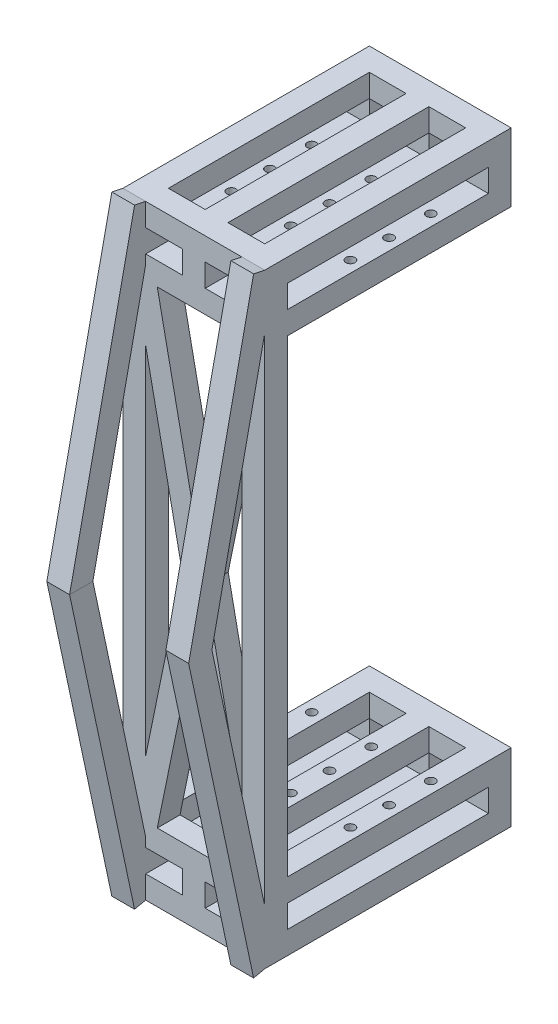
from build123d import *

# Parameters (mm, degrees)
SZKIC2_W                         = 187
SZKIC2_H                         = 90
SZKIC2_W_2                       = 48.5
SZKIC2_H_2                       = 30
DODANIE_WYCI_GNI_CIE1_DEPTH      = 30
DODANIE_WYCI_GNI_CIE1_2_DEPTH    = 30
SZKIC3_W                         = 187
SZKIC3_H                         = 90
SZKIC3_W_2                       = 48.5
SZKIC3_H_2                       = 30
DODANIE_WYCI_GNI_CIE2_DEPTH      = 30
DODANIE_WYCI_GNI_CIE2_2_DEPTH    = 30
SZKIC4_W                         = 30
SZKIC4_H                         = 30
DODANIE_WYCI_GNI_CIE3_DEPTH      = 295
DODANIE_WYCI_GNI_CIE4_DEPTH      = 30
OTWORY_USTALAJ_CE_12_0MM1_REACH  = 803.16
OTWORY_USTALAJ_CE_12_0MM1_BORE_R = 6
OTWORY_USTALAJ_CE_12_0MM2_REACH  = 803.16
OTWORY_USTALAJ_CE_12_0MM2_BORE_R = 6
OTWORY_USTALAJ_CE_12_0MM3_REACH  = 803.16
OTWORY_USTALAJ_CE_12_0MM3_BORE_R = 6
SZKIC18_W                        = 30
SZKIC18_H                        = 30
SKORUPA4_START                   = 3
SKORUPA4_OUTLINE_W               = 24
SKORUPA4_OUTLINE_H               = 24
SKORUPA4_OUTLINE_W_2             = 672
SKORUPA4_DEPTH                   = 181
SKORUPA4_2_OUTLINE_W             = 24
SKORUPA4_2_OUTLINE_H             = 271
SKORUPA4_2_OUTLINE_W_2           = 36
SKORUPA4_2_OUTLINE_H_2           = 24
SKORUPA4_2_DEPTH                 = 24
SKORUPA4_START_2                 = 160
SKORUPA4_3_OUTLINE_W             = 24
SKORUPA4_3_OUTLINE_H             = 271
SKORUPA4_3_OUTLINE_W_2           = 36
SKORUPA4_3_OUTLINE_H_2           = 24
SKORUPA4_3_DEPTH                 = 24
SKORUPA4_START_3                 = 81.5
SKORUPA4_4_OUTLINE_W             = 24
SKORUPA4_4_OUTLINE_H             = 271
SKORUPA4_4_OUTLINE_W_2           = 36
SKORUPA4_4_OUTLINE_H_2           = 24
SKORUPA4_4_DEPTH                 = 24
SKORUPA4_START_4                 = 298
SKORUPA4_5_DEPTH                 = 25
SKORUPA4_START_5                 = -736
SKORUPA4_6_OUTLINE_R             = 9
SKORUPA4_6_OUTLINE_R_2           = 6
SKORUPA4_6_DEPTH                 = 25
SKORUPA4_START_6                 = -87
SKORUPA4_7_OUTLINE_R             = 9
SKORUPA4_7_OUTLINE_R_2           = 6
SKORUPA4_7_DEPTH                 = 25


with BuildPart() as part:
    # Szkic2 → Dodanie-wyciągnięcie1 (new body)
    with BuildSketch(Plane(origin=(0, 0, 0), x_dir=(-1, 0, 0), z_dir=(0, 0, 1))):
        with Locations((-93.5, 753)):
            Rectangle(SZKIC2_W, SZKIC2_H)
        with Locations((-132.75, 753)):
            Rectangle(SZKIC2_W_2, SZKIC2_H_2, mode=Mode.SUBTRACT)
        with Locations((-54.25, 753)):
            Rectangle(SZKIC2_W_2, SZKIC2_H_2, mode=Mode.SUBTRACT)
    extrude(amount=DODANIE_WYCI_GNI_CIE1_DEPTH)



with BuildPart() as body_2:
    # Szkic2 → Dodanie-wyci_gni_cie1 2 (new body)
    with BuildSketch(Plane(origin=(0, 0, 0), x_dir=(-1, 0, 0), z_dir=(0, 0, 1))):
        with Locations((-93.5, 45)):
            Rectangle(SZKIC2_W, SZKIC2_H)
        with Locations((-54.25, 45)):
            Rectangle(SZKIC2_W_2, SZKIC2_H_2, mode=Mode.SUBTRACT)
        with Locations((-132.75, 45)):
            Rectangle(SZKIC2_W_2, SZKIC2_H_2, mode=Mode.SUBTRACT)
    extrude(amount=DODANIE_WYCI_GNI_CIE1_2_DEPTH)


with BuildPart() as body_3:
    # Szkic3 → Dodanie-wyciągnięcie2 (new body)
    with BuildSketch(Plane.XY.offset(295)):
        with Locations((93.5, -753)):
            Rectangle(SZKIC3_W, SZKIC3_H)
        with Locations((132.75, -753)):
            Rectangle(SZKIC3_W_2, SZKIC3_H_2, mode=Mode.SUBTRACT)
        with Locations((54.25, -753)):
            Rectangle(SZKIC3_W_2, SZKIC3_H_2, mode=Mode.SUBTRACT)
    extrude(amount=DODANIE_WYCI_GNI_CIE2_DEPTH)


with BuildPart() as body_4:
    # Szkic3 → Dodanie-wyci_gni_cie2 2 (new body)
    with BuildSketch(Plane.XY.offset(295)):
        with Locations((93.5, -45)):
            Rectangle(SZKIC3_W, SZKIC3_H)
        with Locations((132.75, -45)):
            Rectangle(SZKIC3_W_2, SZKIC3_H_2, mode=Mode.SUBTRACT)
        with Locations((54.25, -45)):
            Rectangle(SZKIC3_W_2, SZKIC3_H_2, mode=Mode.SUBTRACT)
    extrude(amount=DODANIE_WYCI_GNI_CIE2_2_DEPTH)


with BuildPart() as part_1:
    add(part.part)

    add(body_2.part)  # Dodanie-wyciągnięcie3 merges body 2

    add(body_3.part)  # Dodanie-wyciągnięcie3 merges body 3

    add(body_4.part)  # Dodanie-wyciągnięcie3 merges body 4
    # Szkic4 → Dodanie-wyciągnięcie3 (add)
    with BuildSketch(Plane.XY.offset(30)):
        with Locations((15, -15)):
            Rectangle(SZKIC4_W, SZKIC4_H)
        with Locations((93.5, -15)):
            Rectangle(SZKIC4_W, SZKIC4_H)
        with Locations((172, -15)):
            Rectangle(SZKIC4_W, SZKIC4_H)
        with Locations((172, -75)):
            Rectangle(SZKIC4_W, SZKIC4_H)
        with Locations((93.5, -75)):
            Rectangle(SZKIC4_W, SZKIC4_H)
        with Locations((15, -75)):
            Rectangle(SZKIC4_W, SZKIC4_H)
        with Locations((15, -723)):
            Rectangle(SZKIC4_W, SZKIC4_H)
        with Locations((93.5, -723)):
            Rectangle(SZKIC4_W, SZKIC4_H)
        with Locations((172, -723)):
            Rectangle(SZKIC4_W, SZKIC4_H)
        with Locations((172, -783)):
            Rectangle(SZKIC4_W, SZKIC4_H)
        with Locations((93.5, -783)):
            Rectangle(SZKIC4_W, SZKIC4_H)
        with Locations((15, -783)):
            Rectangle(SZKIC4_W, SZKIC4_H)
    extrude(amount=DODANIE_WYCI_GNI_CIE3_DEPTH)

    # Szkic5 → Dodanie-wyciągnięcie4 (add)
    with BuildSketch(Plane.XY.offset(325)):
        Polygon((187, -90), (187, -708), (141.686543307, -708), (93.5, -473.517450679), (45.313456693, -708), (0, -708), (0, -90), (45.313456693, -90), (93.5, -324.482549321), (141.686543307, -90), align=None)
        Polygon((157, -164.517450679), (157, -633.482549321), (108.813456693, -399), align=None, mode=Mode.SUBTRACT)
        Polygon((30, -164.517450679), (30, -633.482549321), (78.186543307, -399), align=None, mode=Mode.SUBTRACT)
    extrude(amount=-DODANIE_WYCI_GNI_CIE4_DEPTH)

    # Otwory ustalające Ø12.0mm1 bore → Otwory ustalające Ø12.0mm1 (cut, up to next)
    with BuildSketch(Plane(origin=(0, -708, 0), x_dir=(1, 0, 0), z_dir=(0, 1, 0)), mode=Mode.PRIVATE) as otwory_ustalaj_ce_12_0mm1_sk1:
        with Locations((172, -146)):
            Circle(OTWORY_USTALAJ_CE_12_0MM1_BORE_R)
    otwory_ustalaj_ce_12_0mm1_tool1 = extrude(otwory_ustalaj_ce_12_0mm1_sk1.sketch, amount=-OTWORY_USTALAJ_CE_12_0MM1_REACH, mode=Mode.PRIVATE) & part_1.part
    # Otwory ustalające Ø12.0mm1 bore → Otwory ustalające Ø12.0mm1 (cut, up to next)
    with BuildSketch(Plane(origin=(0, -708, 0), x_dir=(1, 0, 0), z_dir=(0, 1, 0)), mode=Mode.PRIVATE) as otwory_ustalaj_ce_12_0mm1_sk2:
        with Locations((172, -197)):
            Circle(OTWORY_USTALAJ_CE_12_0MM1_BORE_R)
    otwory_ustalaj_ce_12_0mm1_tool2 = extrude(otwory_ustalaj_ce_12_0mm1_sk2.sketch, amount=-OTWORY_USTALAJ_CE_12_0MM1_REACH, mode=Mode.PRIVATE) & part_1.part
    # Otwory ustalające Ø12.0mm1 bore → Otwory ustalające Ø12.0mm1 (cut, up to next)
    with BuildSketch(Plane(origin=(0, -708, 0), x_dir=(1, 0, 0), z_dir=(0, 1, 0)), mode=Mode.PRIVATE) as otwory_ustalaj_ce_12_0mm1_sk3:
        with Locations((172, -91)):
            Circle(OTWORY_USTALAJ_CE_12_0MM1_BORE_R)
    otwory_ustalaj_ce_12_0mm1_tool3 = extrude(otwory_ustalaj_ce_12_0mm1_sk3.sketch, amount=-OTWORY_USTALAJ_CE_12_0MM1_REACH, mode=Mode.PRIVATE) & part_1.part
    otwory_ustalaj_ce_12_0mm1_1 = otwory_ustalaj_ce_12_0mm1_tool1.solids().sort_by_distance((172, -708, 146))[0]
    add(otwory_ustalaj_ce_12_0mm1_1, mode=Mode.SUBTRACT)
    otwory_ustalaj_ce_12_0mm1_2 = otwory_ustalaj_ce_12_0mm1_tool2.solids().sort_by_distance((172, -708, 197))[0]
    add(otwory_ustalaj_ce_12_0mm1_2, mode=Mode.SUBTRACT)
    otwory_ustalaj_ce_12_0mm1_3 = otwory_ustalaj_ce_12_0mm1_tool3.solids().sort_by_distance((172, -708, 91))[0]
    add(otwory_ustalaj_ce_12_0mm1_3, mode=Mode.SUBTRACT)
    otwory_ustalaj_ce_12_0mm1 = otwory_ustalaj_ce_12_0mm1_1 + otwory_ustalaj_ce_12_0mm1_2 + otwory_ustalaj_ce_12_0mm1_3  # Otwory ustalające Ø12.0mm1 as one shape, for the pattern or mirror that repeats it

    # Otwory ustalające Ø12.0mm2 bore → Otwory ustalające Ø12.0mm2 (cut, up to next)
    with BuildSketch(Plane(origin=(0, -708, 0), x_dir=(1, 0, 0), z_dir=(0, 1, 0)), mode=Mode.PRIVATE) as otwory_ustalaj_ce_12_0mm2_sk1:
        with Locations((93.5, -146)):
            Circle(OTWORY_USTALAJ_CE_12_0MM2_BORE_R)
    otwory_ustalaj_ce_12_0mm2_tool1 = extrude(otwory_ustalaj_ce_12_0mm2_sk1.sketch, amount=-OTWORY_USTALAJ_CE_12_0MM2_REACH, mode=Mode.PRIVATE) & part_1.part
    # Otwory ustalające Ø12.0mm2 bore → Otwory ustalające Ø12.0mm2 (cut, up to next)
    with BuildSketch(Plane(origin=(0, -708, 0), x_dir=(1, 0, 0), z_dir=(0, 1, 0)), mode=Mode.PRIVATE) as otwory_ustalaj_ce_12_0mm2_sk2:
        with Locations((93.5, -91)):
            Circle(OTWORY_USTALAJ_CE_12_0MM2_BORE_R)
    otwory_ustalaj_ce_12_0mm2_tool2 = extrude(otwory_ustalaj_ce_12_0mm2_sk2.sketch, amount=-OTWORY_USTALAJ_CE_12_0MM2_REACH, mode=Mode.PRIVATE) & part_1.part
    # Otwory ustalające Ø12.0mm2 bore → Otwory ustalające Ø12.0mm2 (cut, up to next)
    with BuildSketch(Plane(origin=(0, -708, 0), x_dir=(1, 0, 0), z_dir=(0, 1, 0)), mode=Mode.PRIVATE) as otwory_ustalaj_ce_12_0mm2_sk3:
        with Locations((93.5, -197)):
            Circle(OTWORY_USTALAJ_CE_12_0MM2_BORE_R)
    otwory_ustalaj_ce_12_0mm2_tool3 = extrude(otwory_ustalaj_ce_12_0mm2_sk3.sketch, amount=-OTWORY_USTALAJ_CE_12_0MM2_REACH, mode=Mode.PRIVATE) & part_1.part
    otwory_ustalaj_ce_12_0mm2_1 = otwory_ustalaj_ce_12_0mm2_tool1.solids().sort_by_distance((93.5, -708, 146))[0]
    add(otwory_ustalaj_ce_12_0mm2_1, mode=Mode.SUBTRACT)
    otwory_ustalaj_ce_12_0mm2_2 = otwory_ustalaj_ce_12_0mm2_tool2.solids().sort_by_distance((93.5, -708, 91))[0]
    add(otwory_ustalaj_ce_12_0mm2_2, mode=Mode.SUBTRACT)
    otwory_ustalaj_ce_12_0mm2_3 = otwory_ustalaj_ce_12_0mm2_tool3.solids().sort_by_distance((93.5, -708, 197))[0]
    add(otwory_ustalaj_ce_12_0mm2_3, mode=Mode.SUBTRACT)
    otwory_ustalaj_ce_12_0mm2 = otwory_ustalaj_ce_12_0mm2_1 + otwory_ustalaj_ce_12_0mm2_2 + otwory_ustalaj_ce_12_0mm2_3  # Otwory ustalające Ø12.0mm2 as one shape, for the pattern or mirror that repeats it

    # Otwory ustalające Ø12.0mm3 bore → Otwory ustalające Ø12.0mm3 (cut, up to next)
    with BuildSketch(Plane(origin=(0, -708, 0), x_dir=(1, 0, 0), z_dir=(0, 1, 0)), mode=Mode.PRIVATE) as otwory_ustalaj_ce_12_0mm3_sk1:
        with Locations((15, -146)):
            Circle(OTWORY_USTALAJ_CE_12_0MM3_BORE_R)
    otwory_ustalaj_ce_12_0mm3_tool1 = extrude(otwory_ustalaj_ce_12_0mm3_sk1.sketch, amount=-OTWORY_USTALAJ_CE_12_0MM3_REACH, mode=Mode.PRIVATE) & part_1.part
    # Otwory ustalające Ø12.0mm3 bore → Otwory ustalające Ø12.0mm3 (cut, up to next)
    with BuildSketch(Plane(origin=(0, -708, 0), x_dir=(1, 0, 0), z_dir=(0, 1, 0)), mode=Mode.PRIVATE) as otwory_ustalaj_ce_12_0mm3_sk2:
        with Locations((15, -91)):
            Circle(OTWORY_USTALAJ_CE_12_0MM3_BORE_R)
    otwory_ustalaj_ce_12_0mm3_tool2 = extrude(otwory_ustalaj_ce_12_0mm3_sk2.sketch, amount=-OTWORY_USTALAJ_CE_12_0MM3_REACH, mode=Mode.PRIVATE) & part_1.part
    # Otwory ustalające Ø12.0mm3 bore → Otwory ustalające Ø12.0mm3 (cut, up to next)
    with BuildSketch(Plane(origin=(0, -708, 0), x_dir=(1, 0, 0), z_dir=(0, 1, 0)), mode=Mode.PRIVATE) as otwory_ustalaj_ce_12_0mm3_sk3:
        with Locations((15, -197)):
            Circle(OTWORY_USTALAJ_CE_12_0MM3_BORE_R)
    otwory_ustalaj_ce_12_0mm3_tool3 = extrude(otwory_ustalaj_ce_12_0mm3_sk3.sketch, amount=-OTWORY_USTALAJ_CE_12_0MM3_REACH, mode=Mode.PRIVATE) & part_1.part
    otwory_ustalaj_ce_12_0mm3_1 = otwory_ustalaj_ce_12_0mm3_tool1.solids().sort_by_distance((15, -708, 146))[0]
    add(otwory_ustalaj_ce_12_0mm3_1, mode=Mode.SUBTRACT)
    otwory_ustalaj_ce_12_0mm3_2 = otwory_ustalaj_ce_12_0mm3_tool2.solids().sort_by_distance((15, -708, 91))[0]
    add(otwory_ustalaj_ce_12_0mm3_2, mode=Mode.SUBTRACT)
    otwory_ustalaj_ce_12_0mm3_3 = otwory_ustalaj_ce_12_0mm3_tool3.solids().sort_by_distance((15, -708, 197))[0]
    add(otwory_ustalaj_ce_12_0mm3_3, mode=Mode.SUBTRACT)
    otwory_ustalaj_ce_12_0mm3 = otwory_ustalaj_ce_12_0mm3_1 + otwory_ustalaj_ce_12_0mm3_2 + otwory_ustalaj_ce_12_0mm3_3  # Otwory ustalające Ø12.0mm3 as one shape, for the pattern or mirror that repeats it

    # Wyciągnięcie po ścieżce1: sweep along a path in Szkic17
    with BuildLine(Plane(origin=(15, 0, 0), x_dir=(0, 0, -1), z_dir=(1, 0, 0))) as wyci_gni_cie_po_cie_ce1_path:
        Line((-325, 0), (-410, -399))
        Line((-410, -399), (-325, -798))
    # Szkic18 → Wyciągnięcie po ścieżce1 (sweep)
    with BuildSketch(Plane(origin=(15, 0, 325), x_dir=(-1, 0, 0), z_dir=(0, -0.9780528166099424, 0.20835711632041382))):
        Rectangle(SZKIC18_W, SZKIC18_H)
    wyci_gni_cie_po_cie_ce1 = sweep(path=wyci_gni_cie_po_cie_ce1_path.line, transition=Transition.RIGHT)

    # Lustro4: Otwory ustalające Ø12.0mm1, Otwory ustalające Ø12.0mm2, Otwory ustalające Ø12.0mm3 across plane
    add(otwory_ustalaj_ce_12_0mm1.mirror(Plane.ZX.offset(-399)), mode=Mode.SUBTRACT)
    add(otwory_ustalaj_ce_12_0mm2.mirror(Plane.ZX.offset(-399)), mode=Mode.SUBTRACT)
    add(otwory_ustalaj_ce_12_0mm3.mirror(Plane.ZX.offset(-399)), mode=Mode.SUBTRACT)

    # Lustro5: Wyciągnięcie po ścieżce1 across plane
    add(wyci_gni_cie_po_cie_ce1.mirror(Plane.ZY.offset(-93.5)))

    # Skorupa4: read off the stored shape, not the designer's step
    # Skorupa4 outline → Skorupa4 (cut)
    with BuildSketch(Plane.YZ.offset(SKORUPA4_START)):
        with Locations((-75, 15)):
            Rectangle(SKORUPA4_OUTLINE_W, SKORUPA4_OUTLINE_H)
        with Locations((-399, 310)):
            Rectangle(SKORUPA4_OUTLINE_W_2, SKORUPA4_OUTLINE_H)
        with Locations((-15, 15)):
            Rectangle(SKORUPA4_OUTLINE_W, SKORUPA4_OUTLINE_H)
        with Locations((-15, 310)):
            Rectangle(SKORUPA4_OUTLINE_W, SKORUPA4_OUTLINE_H)
        with Locations((-723, 15)):
            Rectangle(SKORUPA4_OUTLINE_W, SKORUPA4_OUTLINE_H)
        with Locations((-783, 310)):
            Rectangle(SKORUPA4_OUTLINE_W, SKORUPA4_OUTLINE_H)
        with Locations((-783, 15)):
            Rectangle(SKORUPA4_OUTLINE_W, SKORUPA4_OUTLINE_H)
    extrude(amount=SKORUPA4_DEPTH, mode=Mode.SUBTRACT)

    # Skorupa4 2 outline → Skorupa4 2 (cut)
    with BuildSketch(Plane.YZ.offset(SKORUPA4_START)):
        with Locations((-75, 162.5)):
            Rectangle(SKORUPA4_2_OUTLINE_W, SKORUPA4_2_OUTLINE_H)
        with Locations((-45, 15)):
            Rectangle(SKORUPA4_2_OUTLINE_W_2, SKORUPA4_2_OUTLINE_H_2)
        Polygon((-63, 322), (-63, 298), (-27, 298), (-27, 322), (-3, 322), (-3, 325.316003366), (-0.433873054, 337.361705148), (-399, 422.269276052), (-797.566126946, 337.361705148), (-795, 325.316003366), (-795, 322), (-771, 322), (-771, 298), (-735, 298), (-735, 322), (-754.488927711, 322), (-399, 397.730723948), (-43.511072289, 322), align=None)
        with Locations((-723, 162.5)):
            Rectangle(SKORUPA4_2_OUTLINE_W, SKORUPA4_2_OUTLINE_H)
        with Locations((-15, 162.5)):
            Rectangle(SKORUPA4_2_OUTLINE_W, SKORUPA4_2_OUTLINE_H)
        with Locations((-753, 15)):
            Rectangle(SKORUPA4_2_OUTLINE_W_2, SKORUPA4_2_OUTLINE_H_2)
        with Locations((-783, 162.5)):
            Rectangle(SKORUPA4_2_OUTLINE_W, SKORUPA4_2_OUTLINE_H)
    extrude(amount=SKORUPA4_2_DEPTH, mode=Mode.SUBTRACT)

    # Skorupa4 3 outline → Skorupa4 3 (cut)
    with BuildSketch(Plane.YZ.offset(SKORUPA4_START_2)):
        with Locations((-75, 162.5)):
            Rectangle(SKORUPA4_3_OUTLINE_W, SKORUPA4_3_OUTLINE_H)
        with Locations((-45, 15)):
            Rectangle(SKORUPA4_3_OUTLINE_W_2, SKORUPA4_3_OUTLINE_H_2)
        Polygon((-63, 322), (-63, 298), (-27, 298), (-27, 322), (-3, 322), (-3, 325.316003366), (-0.433873054, 337.361705148), (-399, 422.269276052), (-797.566126946, 337.361705148), (-795, 325.316003366), (-795, 322), (-771, 322), (-771, 298), (-735, 298), (-735, 322), (-754.488927711, 322), (-399, 397.730723948), (-43.511072289, 322), align=None)
        with Locations((-723, 162.5)):
            Rectangle(SKORUPA4_3_OUTLINE_W, SKORUPA4_3_OUTLINE_H)
        with Locations((-15, 162.5)):
            Rectangle(SKORUPA4_3_OUTLINE_W, SKORUPA4_3_OUTLINE_H)
        with Locations((-753, 15)):
            Rectangle(SKORUPA4_3_OUTLINE_W_2, SKORUPA4_3_OUTLINE_H_2)
        with Locations((-783, 162.5)):
            Rectangle(SKORUPA4_3_OUTLINE_W, SKORUPA4_3_OUTLINE_H)
    extrude(amount=SKORUPA4_3_DEPTH, mode=Mode.SUBTRACT)

    # Skorupa4 4 outline → Skorupa4 4 (cut)
    with BuildSketch(Plane.YZ.offset(SKORUPA4_START_3)):
        with Locations((-75, 162.5)):
            Rectangle(SKORUPA4_4_OUTLINE_W, SKORUPA4_4_OUTLINE_H)
        with Locations((-45, 15)):
            Rectangle(SKORUPA4_4_OUTLINE_W_2, SKORUPA4_4_OUTLINE_H_2)
        with Locations((-45, 310)):
            Rectangle(SKORUPA4_4_OUTLINE_W_2, SKORUPA4_4_OUTLINE_H_2)
        with Locations((-723, 162.5)):
            Rectangle(SKORUPA4_4_OUTLINE_W, SKORUPA4_4_OUTLINE_H)
        with Locations((-15, 162.5)):
            Rectangle(SKORUPA4_4_OUTLINE_W, SKORUPA4_4_OUTLINE_H)
        with Locations((-753, 310)):
            Rectangle(SKORUPA4_4_OUTLINE_W_2, SKORUPA4_4_OUTLINE_H_2)
        with Locations((-753, 15)):
            Rectangle(SKORUPA4_4_OUTLINE_W_2, SKORUPA4_4_OUTLINE_H_2)
        with Locations((-783, 162.5)):
            Rectangle(SKORUPA4_4_OUTLINE_W, SKORUPA4_4_OUTLINE_H)
    extrude(amount=SKORUPA4_4_DEPTH, mode=Mode.SUBTRACT)

    # Skorupa4 5 outline → Skorupa4 5 (add)
    # profile 1 of 4: a face of its own
    with BuildSketch(Plane.XY.offset(SKORUPA4_START_4)):
        Polygon((27, -135.015535346), (27, -662.984464654), (81.249234646, -399), align=None)
        Polygon((30, -164.517450679), (78.186543307, -399), (30, -633.482549321), align=None, mode=Mode.SUBTRACT)
    # profile 2 of 4: a face of its own
    with BuildSketch(Plane.XY.offset(SKORUPA4_START_4)):
        Polygon((93.5, -339.386039457), (145.3657395, -87), (41.6342605, -87), align=None)
        Polygon((93.5, -324.482549321), (45.313456693, -90), (141.686543307, -90), align=None, mode=Mode.SUBTRACT)
    # profile 3 of 4: a face of its own
    with BuildSketch(Plane.XY.offset(SKORUPA4_START_4)):
        Polygon((145.3657395, -711), (93.5, -458.613960543), (41.6342605, -711), align=None)
        Polygon((141.686543307, -708), (45.313456693, -708), (93.5, -473.517450679), align=None, mode=Mode.SUBTRACT)
    # profile 4 of 4: a face of its own
    with BuildSketch(Plane.XY.offset(SKORUPA4_START_4)):
        Polygon((105.750765354, -399), (160, -662.984464654), (160, -135.015535346), align=None)
        Polygon((108.813456693, -399), (157, -164.517450679), (157, -633.482549321), align=None, mode=Mode.SUBTRACT)
    extrude(amount=SKORUPA4_5_DEPTH)

    # Skorupa4 6 outline → Skorupa4 6 (add)
    # profile 1 of 9: a face of its own
    with BuildSketch(Plane(origin=(0, 0, 0), x_dir=(1, 0, 0), z_dir=(0, 1, 0)).offset(SKORUPA4_START_5)):
        with Locations((172, -91)):
            Circle(SKORUPA4_6_OUTLINE_R)
        with Locations((172, -91)):
            Circle(SKORUPA4_6_OUTLINE_R_2, mode=Mode.SUBTRACT)
    # profile 2 of 9: a face of its own
    with BuildSketch(Plane(origin=(0, 0, 0), x_dir=(1, 0, 0), z_dir=(0, 1, 0)).offset(SKORUPA4_START_5)):
        with Locations((172, -197)):
            Circle(SKORUPA4_6_OUTLINE_R)
        with Locations((172, -197)):
            Circle(SKORUPA4_6_OUTLINE_R_2, mode=Mode.SUBTRACT)
    # profile 3 of 9: a face of its own
    with BuildSketch(Plane(origin=(0, 0, 0), x_dir=(1, 0, 0), z_dir=(0, 1, 0)).offset(SKORUPA4_START_5)):
        with Locations((172, -146)):
            Circle(SKORUPA4_6_OUTLINE_R)
        with Locations((172, -146)):
            Circle(SKORUPA4_6_OUTLINE_R_2, mode=Mode.SUBTRACT)
    # profile 4 of 9: a face of its own
    with BuildSketch(Plane(origin=(0, 0, 0), x_dir=(1, 0, 0), z_dir=(0, 1, 0)).offset(SKORUPA4_START_5)):
        with Locations((93.5, -197)):
            Circle(SKORUPA4_6_OUTLINE_R)
        with Locations((93.5, -197)):
            Circle(SKORUPA4_6_OUTLINE_R_2, mode=Mode.SUBTRACT)
    # profile 5 of 9: a face of its own
    with BuildSketch(Plane(origin=(0, 0, 0), x_dir=(1, 0, 0), z_dir=(0, 1, 0)).offset(SKORUPA4_START_5)):
        with Locations((93.5, -91)):
            Circle(SKORUPA4_6_OUTLINE_R)
        with Locations((93.5, -91)):
            Circle(SKORUPA4_6_OUTLINE_R_2, mode=Mode.SUBTRACT)
    # profile 6 of 9: a face of its own
    with BuildSketch(Plane(origin=(0, 0, 0), x_dir=(1, 0, 0), z_dir=(0, 1, 0)).offset(SKORUPA4_START_5)):
        with Locations((93.5, -146)):
            Circle(SKORUPA4_6_OUTLINE_R)
        with Locations((93.5, -146)):
            Circle(SKORUPA4_6_OUTLINE_R_2, mode=Mode.SUBTRACT)
    # profile 7 of 9: a face of its own
    with BuildSketch(Plane(origin=(0, 0, 0), x_dir=(1, 0, 0), z_dir=(0, 1, 0)).offset(SKORUPA4_START_5)):
        with Locations((15, -197)):
            Circle(SKORUPA4_6_OUTLINE_R)
        with Locations((15, -197)):
            Circle(SKORUPA4_6_OUTLINE_R_2, mode=Mode.SUBTRACT)
    # profile 8 of 9: a face of its own
    with BuildSketch(Plane(origin=(0, 0, 0), x_dir=(1, 0, 0), z_dir=(0, 1, 0)).offset(SKORUPA4_START_5)):
        with Locations((15, -91)):
            Circle(SKORUPA4_6_OUTLINE_R)
        with Locations((15, -91)):
            Circle(SKORUPA4_6_OUTLINE_R_2, mode=Mode.SUBTRACT)
    # profile 9 of 9: a face of its own
    with BuildSketch(Plane(origin=(0, 0, 0), x_dir=(1, 0, 0), z_dir=(0, 1, 0)).offset(SKORUPA4_START_5)):
        with Locations((15, -146)):
            Circle(SKORUPA4_6_OUTLINE_R)
        with Locations((15, -146)):
            Circle(SKORUPA4_6_OUTLINE_R_2, mode=Mode.SUBTRACT)
    extrude(amount=SKORUPA4_6_DEPTH)

    # Skorupa4 7 outline → Skorupa4 7 (add)
    # profile 1 of 9: a face of its own
    with BuildSketch(Plane(origin=(0, 0, 0), x_dir=(1, 0, 0), z_dir=(0, 1, 0)).offset(SKORUPA4_START_6)):
        with Locations((172, -91)):
            Circle(SKORUPA4_7_OUTLINE_R)
        with Locations((172, -91)):
            Circle(SKORUPA4_7_OUTLINE_R_2, mode=Mode.SUBTRACT)
    # profile 2 of 9: a face of its own
    with BuildSketch(Plane(origin=(0, 0, 0), x_dir=(1, 0, 0), z_dir=(0, 1, 0)).offset(SKORUPA4_START_6)):
        with Locations((172, -197)):
            Circle(SKORUPA4_7_OUTLINE_R)
        with Locations((172, -197)):
            Circle(SKORUPA4_7_OUTLINE_R_2, mode=Mode.SUBTRACT)
    # profile 3 of 9: a face of its own
    with BuildSketch(Plane(origin=(0, 0, 0), x_dir=(1, 0, 0), z_dir=(0, 1, 0)).offset(SKORUPA4_START_6)):
        with Locations((172, -146)):
            Circle(SKORUPA4_7_OUTLINE_R)
        with Locations((172, -146)):
            Circle(SKORUPA4_7_OUTLINE_R_2, mode=Mode.SUBTRACT)
    # profile 4 of 9: a face of its own
    with BuildSketch(Plane(origin=(0, 0, 0), x_dir=(1, 0, 0), z_dir=(0, 1, 0)).offset(SKORUPA4_START_6)):
        with Locations((93.5, -197)):
            Circle(SKORUPA4_7_OUTLINE_R)
        with Locations((93.5, -197)):
            Circle(SKORUPA4_7_OUTLINE_R_2, mode=Mode.SUBTRACT)
    # profile 5 of 9: a face of its own
    with BuildSketch(Plane(origin=(0, 0, 0), x_dir=(1, 0, 0), z_dir=(0, 1, 0)).offset(SKORUPA4_START_6)):
        with Locations((93.5, -91)):
            Circle(SKORUPA4_7_OUTLINE_R)
        with Locations((93.5, -91)):
            Circle(SKORUPA4_7_OUTLINE_R_2, mode=Mode.SUBTRACT)
    # profile 6 of 9: a face of its own
    with BuildSketch(Plane(origin=(0, 0, 0), x_dir=(1, 0, 0), z_dir=(0, 1, 0)).offset(SKORUPA4_START_6)):
        with Locations((93.5, -146)):
            Circle(SKORUPA4_7_OUTLINE_R)
        with Locations((93.5, -146)):
            Circle(SKORUPA4_7_OUTLINE_R_2, mode=Mode.SUBTRACT)
    # profile 7 of 9: a face of its own
    with BuildSketch(Plane(origin=(0, 0, 0), x_dir=(1, 0, 0), z_dir=(0, 1, 0)).offset(SKORUPA4_START_6)):
        with Locations((15, -197)):
            Circle(SKORUPA4_7_OUTLINE_R)
        with Locations((15, -197)):
            Circle(SKORUPA4_7_OUTLINE_R_2, mode=Mode.SUBTRACT)
    # profile 8 of 9: a face of its own
    with BuildSketch(Plane(origin=(0, 0, 0), x_dir=(1, 0, 0), z_dir=(0, 1, 0)).offset(SKORUPA4_START_6)):
        with Locations((15, -91)):
            Circle(SKORUPA4_7_OUTLINE_R)
        with Locations((15, -91)):
            Circle(SKORUPA4_7_OUTLINE_R_2, mode=Mode.SUBTRACT)
    # profile 9 of 9: a face of its own
    with BuildSketch(Plane(origin=(0, 0, 0), x_dir=(1, 0, 0), z_dir=(0, 1, 0)).offset(SKORUPA4_START_6)):
        with Locations((15, -146)):
            Circle(SKORUPA4_7_OUTLINE_R)
        with Locations((15, -146)):
            Circle(SKORUPA4_7_OUTLINE_R_2, mode=Mode.SUBTRACT)
    extrude(amount=SKORUPA4_7_DEPTH)


solid = part_1.part
